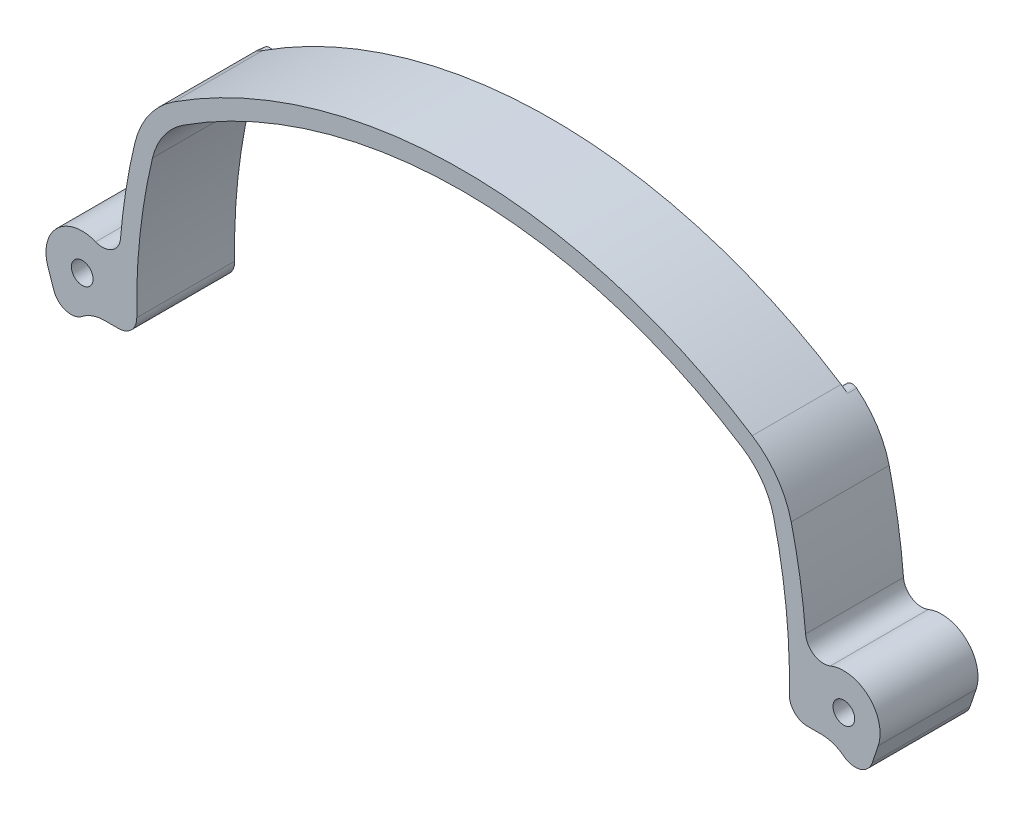
from build123d import *

# Parameters (mm, degrees)
BOSS_EXTRUDE1_DEPTH   = 17.145
BOSS_EXTRUDE2_START   = -17.145
BOSS_EXTRUDE2_DEPTH   = 17.145
F_6_CLEARANCE_HOLE3_D = 3.7973
CUT_EXTRUDE2_DEPTH    = 6.35
FILLET1_R             = 3.175
CUT_EXTRUDE3_DEPTH    = 1.5875
FILLET2_R             = 1.27


with BuildPart() as part:
    # Sketch1 → Boss-Extrude1 (new body)
    with BuildSketch(Plane.XY):
        with BuildLine():
            Line((-60.325, -44.9072), (-57.15, -44.9072))
            ThreePointArc((-57.15, -44.9072), (-56.454091105, -33.036041743), (-54.37589767, -21.327506412))
            ThreePointArc((-54.37589767, -21.327506412), (-52.38952724, -16.938887877), (-48.911621193, -13.605749768))
            ThreePointArc((-48.911621193, -13.605749768), (0, 0.8128), (48.911621193, -13.605749768))
            ThreePointArc((48.911621193, -13.605749768), (52.38952724, -16.938887877), (54.37589767, -21.327506412))
            ThreePointArc((54.37589767, -21.327506412), (56.454091105, -33.036041743), (57.15, -44.9072))
            Line((57.15, -44.9072), (60.325, -44.9072))
            ThreePointArc((60.325, -44.9072), (59.607343952, -32.665068047), (57.464206972, -20.590640987))
            ThreePointArc((57.464206972, -20.590640987), (54.981243935, -15.104867818), (50.633861375, -10.938445182))
            ThreePointArc((50.633861375, -10.938445182), (0, 3.9878), (-50.633861375, -10.938445182))
            ThreePointArc((-50.633861375, -10.938445182), (-54.981243935, -15.104867818), (-57.464206972, -20.590640987))
            ThreePointArc((-57.464206972, -20.590640987), (-59.607343952, -32.665068047), (-60.325, -44.9072))
        make_face()
    extrude(amount=BOSS_EXTRUDE1_DEPTH)

    # Sketch5 → Boss-Extrude2 (add)
    with BuildSketch(Plane.XY.offset(17.145).offset(BOSS_EXTRUDE2_START)):
        with BuildLine():
            Line((-72.692160527, -46.93606155), (-71.648700283, -50.030736885))
            ThreePointArc((-71.648700283, -50.030736885), (-69.548845385, -52.05848349), (-66.680845425, -51.514679193))
            ThreePointArc((-66.680845425, -51.514679193), (-64.835115794, -50.509265825), (-62.762296236, -50.16142536))
            Line((-62.762296236, -50.16142536), (-60.304367197, -50.16142536))
            ThreePointArc((-60.304367197, -50.16142536), (-58.037136322, -49.209101486), (-57.129992434, -46.923418531))
            ThreePointArc((-57.129992434, -46.923418531), (-57.144997985, -45.9153589), (-57.15, -44.9072))
            Line((-57.15, -44.9072), (-60.325, -44.9072))
            ThreePointArc((-60.325, -44.9072), (-67.702990917, -38.640962319), (-72.692160527, -46.93606155))
        make_face()
    boss_extrude2 = extrude(amount=BOSS_EXTRUDE2_DEPTH)

    # #6 Clearance Hole3 (through all)
    with Locations(Plane(origin=(0, 0, 0), x_dir=(-1, 0, 0), z_dir=(0, 0, -1))):
        with Locations((66.675, -44.9072)):
            f_6_clearance_hole3 = Hole(F_6_CLEARANCE_HOLE3_D / 2)

    # Sketch9 → Cut-Extrude2 (cut)
    with BuildSketch(Plane(origin=(0, 0, 0), x_dir=(-1, 0, 0), z_dir=(0, 0, -1))):
        Polygon((69.076344107, -40.74795), (64.273655893, -40.74795), (61.872311786, -44.9072), (64.273655893, -49.06645), (69.076344107, -49.06645), (71.477688214, -44.9072), align=None)
    cut_extrude2 = extrude(amount=-CUT_EXTRUDE2_DEPTH, mode=Mode.SUBTRACT)

    # Mirror1: Boss-Extrude2, #6 Clearance Hole3, Cut-Extrude2 across plane
    add(boss_extrude2.mirror(Plane(origin=(0, 0, 0), x_dir=(0, 0, 1), z_dir=(1, 0, 0))))
    add(f_6_clearance_hole3.mirror(Plane(origin=(0, 0, 0), x_dir=(0, 0, 1), z_dir=(1, 0, 0))), mode=Mode.SUBTRACT)
    add(cut_extrude2.mirror(Plane(origin=(0, 0, 0), x_dir=(0, 0, 1), z_dir=(1, 0, 0))), mode=Mode.SUBTRACT)

    # Fillet1
    # the kernel refuses this fillet: 3.175 mm, written as the material it adds along each edge
    with BuildSketch(Plane(origin=(60.325, -44.9072, 0), x_dir=(0.5606119105814275, 0.8280786712107985, 0), z_dir=(0, 0, 1))) as fillet1_piece_1:
        with BuildLine():
            CenterArc((8.89971408, 2.629149781), FILLET1_R, 128.797238818, 107.104635177)
            Line((6.910366227, 5.103643693), (6.87057927, 5.153133571))
            ThreePointArc((6.87057927, 5.153133571), (3.469787737, 2.532047093), (-0.035598856, 0.052582996))
            Line((-0.035598856, 0.052582996), (0.035598856, -0.052582996))
            ThreePointArc((0.035598856, -0.052582996), (3.559885632, 1.028200438), (7.084172408, -0.052582996))
            Line((7.084172408, -0.052582996), (7.119771264, 0))
        make_face()
    extrude(amount=17.145)
    fillet1_2_edges = [part.edges().sort_by_distance(p)[0] for p in [
        (-60.325, -44.9072, 8.5725),
    ]]
    fillet(fillet1_2_edges, radius=FILLET1_R)

    # Sketch10 → Cut-Extrude3 (cut)
    with BuildSketch(Plane(origin=(0, 0, 0), x_dir=(-1, 0, 0), z_dir=(0, 0, -1))):
        with BuildLine():
            Line((-50.633861375, -10.938445182), (-48.911621193, -13.605749768))
            ThreePointArc((-48.911621193, -13.605749768), (0, 0.8128), (48.911621193, -13.605749768))
            Line((48.911621193, -13.605749768), (50.633861375, -10.938445182))
            ThreePointArc((50.633861375, -10.938445182), (0, 3.9878), (-50.633861375, -10.938445182))
        make_face()
    extrude(amount=-CUT_EXTRUDE3_DEPTH, mode=Mode.SUBTRACT)

    # Fillet2
    fillet2_edges = [part.edges().sort_by_distance(p)[0] for p in [
        (50.633861375, -10.938445182, 0.79375),
        (-50.633861375, -10.938445182, 0.79375),
        (-48.911621193, -13.605749768, 0.79375),
        (48.911621193, -13.605749768, 0.79375),
    ]]
    fillet(fillet2_edges, radius=FILLET2_R)


solid = part.part
